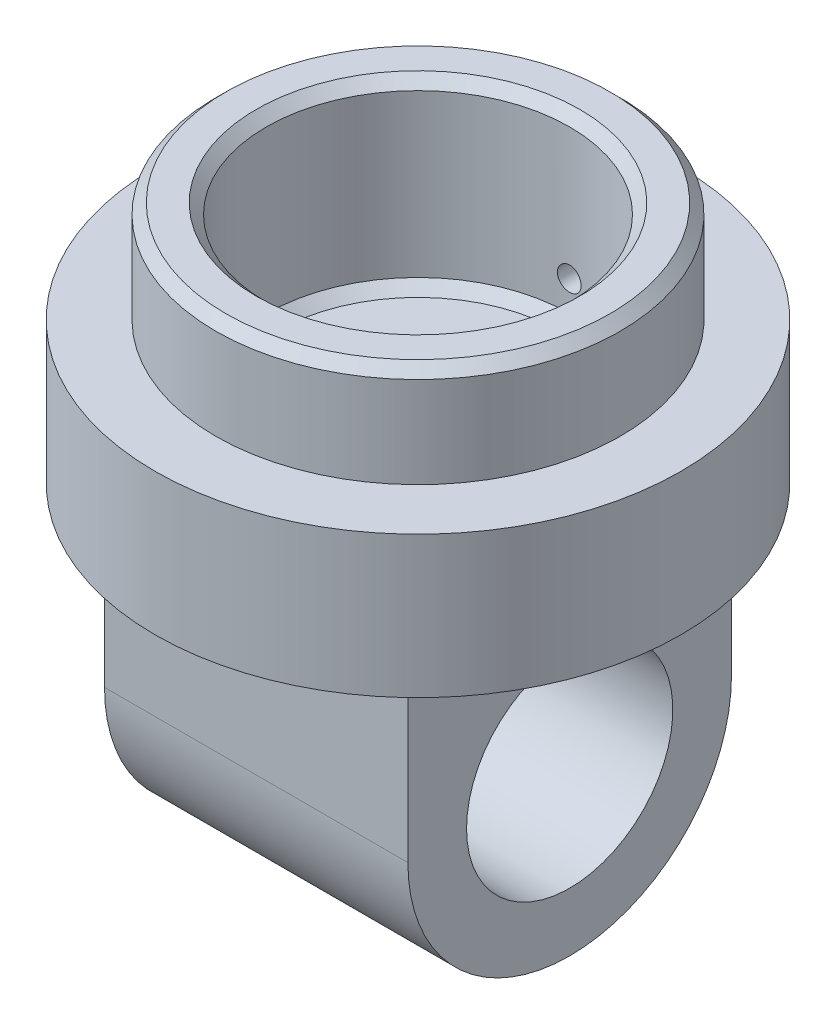
from build123d import *

# Parameters (mm, degrees)
SKETCH1_R           = 13
BOSS_EXTRUDE1_DEPTH = 7
SKETCH2_R           = 10
BOSS_EXTRUDE2_DEPTH = 5
SKETCH3_R           = 7.5
CUT_EXTRUDE1_DEPTH  = 9
CHAMFER1_SIZE       = 0.5
SKETCH4_R           = 0.585
CUT_EXTRUDE2_DEPTH  = 22.9544984
SKETCH5_W           = 15
SKETCH5_H           = 16
BOSS_EXTRUDE3_DEPTH = 16.5
FILLET1_R           = 8
SKETCH8_R           = 5.1
CUT_EXTRUDE4_DEPTH  = 15
SKETCH9_R           = 1.17
CUT_EXTRUDE5_DEPTH  = 1


with BuildPart() as part:
    # Sketch1 → Boss-Extrude1 (new body)
    with BuildSketch(Plane(origin=(0, 0, 0), x_dir=(1, 0, 0), z_dir=(0, 1, 0))):
        with Locations(Location((0, 0, 0), (0, 0, 270))):
            Circle(SKETCH1_R)
    extrude(amount=BOSS_EXTRUDE1_DEPTH)

    # Sketch2 → Boss-Extrude2 (add)
    with BuildSketch(Plane(origin=(0, 7, 0), x_dir=(1, 0, 0), z_dir=(0, 1, 0))):
        with Locations(Location((0, 0, 0), (0, 0, 270))):
            Circle(SKETCH2_R)
    extrude(amount=BOSS_EXTRUDE2_DEPTH)

    # Sketch3 → Cut-Extrude1 (cut)
    with BuildSketch(Plane(origin=(0, 12, 0), x_dir=(1, 0, 0), z_dir=(0, 1, 0))):
        with Locations(Location((0, 0, 0), (0, 0, 270))):
            Circle(SKETCH3_R)
    extrude(amount=-CUT_EXTRUDE1_DEPTH, mode=Mode.SUBTRACT)

    # Chamfer1
    chamfer1_edges = [part.edges().sort_by_distance(p)[0] for p in [
        (0, 3, -7.5),
        (0, 12, -7.5),
        (0, 12, -10),
    ]]
    chamfer(chamfer1_edges, length=CHAMFER1_SIZE)

    # Sketch4 → Cut-Extrude2 (cut, through all)
    with BuildSketch(Plane.XY):
        with Locations((0, 5)):
            Circle(SKETCH4_R)
    extrude(amount=-CUT_EXTRUDE2_DEPTH, mode=Mode.SUBTRACT)

    # Sketch5 → Boss-Extrude3 (add)
    with BuildSketch(Plane.XZ):
        Rectangle(SKETCH5_W, SKETCH5_H)
    extrude(amount=BOSS_EXTRUDE3_DEPTH)

    # Fillet1
    fillet1_edges = [part.edges().sort_by_distance(p)[0] for p in [
        (0, -16.5, 8),
        (0, -16.5, -8),
    ]]
    fillet(fillet1_edges, radius=FILLET1_R - 0.0001)  # a hair under: the kernel refuses the full size

    # Sketch8 → Cut-Extrude4 (cut)
    with BuildSketch(Plane.ZY.offset(7.5)):
        with Locations((0, -8.5)):
            Circle(SKETCH8_R)
    extrude(amount=-CUT_EXTRUDE4_DEPTH, mode=Mode.SUBTRACT)

    # Sketch9 → Cut-Extrude5 (cut)
    with BuildSketch(Plane(origin=(0, 0, -13), x_dir=(-1, 0, 0), z_dir=(0, 0, -1))):
        with Locations((0, 5)):
            Circle(SKETCH9_R)
    extrude(amount=-CUT_EXTRUDE5_DEPTH, mode=Mode.SUBTRACT)


solid = part.part
